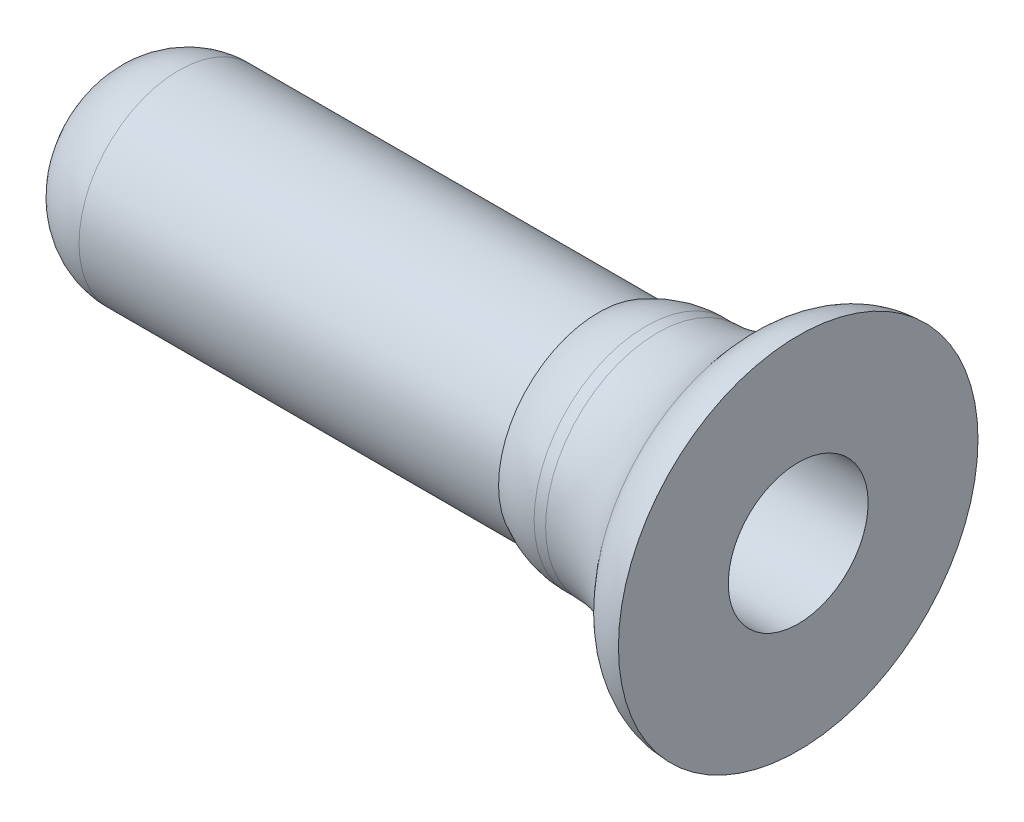
from build123d import *

# Parameters (mm, degrees)
SKETCH2_R          = 3.5
CUT_EXTRUDE1_DEPTH = 10
FILLET7_R          = 3
FILLET8_R          = 6
FILLET9_R          = 5
FILLET10_R         = 4


# Some blends are built 0.0001 mm under size
with BuildPart() as part:
    # Sketch1 → Revolve1 (revolve)
    with BuildSketch(Plane(origin=(0, 0, 0), x_dir=(1, 0, 0), z_dir=(0, 1, 0)), mode=Mode.PRIVATE) as revolve1_sk:
        Polygon((0, 0), (0, 9), (-3, 9), (-3, 5.60541789), (-10, 5.60541789), (-10, 5), (-35, 5), (-35, 0), align=None)
    revolve(revolve1_sk.sketch.rotate(Axis((-35, 0, 0), (1, 0, 0)), 180), axis=Axis((-35, 0, 0), (1, 0, 0)))

    # Sketch2 → Cut-Extrude1 (cut)
    with BuildSketch(Plane(origin=(0, 0, 0), x_dir=(0, 0, -1), z_dir=(1, 0, 0))):
        Circle(SKETCH2_R)
    extrude(amount=-CUT_EXTRUDE1_DEPTH, mode=Mode.SUBTRACT)

    # Fillet7
    fillet7_edges = [part.edges().sort_by_distance(p)[0] for p in [
        (-3, 0, -9),
    ]]
    fillet(fillet7_edges, radius=FILLET7_R - 0.0001)  # a hair under: the kernel refuses the full size

    # Fillet8
    fillet8_edges = [part.edges().sort_by_distance(p)[0] for p in [
        (-3, 0, -5.60541789),
    ]]
    fillet(fillet8_edges, radius=FILLET8_R)

    # Fillet9
    # the kernel refuses this fillet: 5 mm, written as the material it takes off along each edge
    with BuildSketch(Plane(origin=(-10, 0, 0), x_dir=(0, 0, 1), z_dir=(0, 1, 0))) as fillet9_piece_1:
        with BuildLine():
            CenterArc((0.60541789, 2.384879049), FILLET9_R, 331.51192705, 28.48807295)
            Line((5, 0), (5.60541789, 0))
            Line((5.60541789, 0), (5.60541789, 2.384879049))
        make_face()
    revolve(axis=Axis((-10, 0, 0), (1, 0, 0)), mode=Mode.SUBTRACT)

    # Fillet10
    fillet10_edges = [part.edges().sort_by_distance(p)[0] for p in [
        (-35, 0, -5),
    ]]
    fillet(fillet10_edges, radius=FILLET10_R)


solid = part.part
